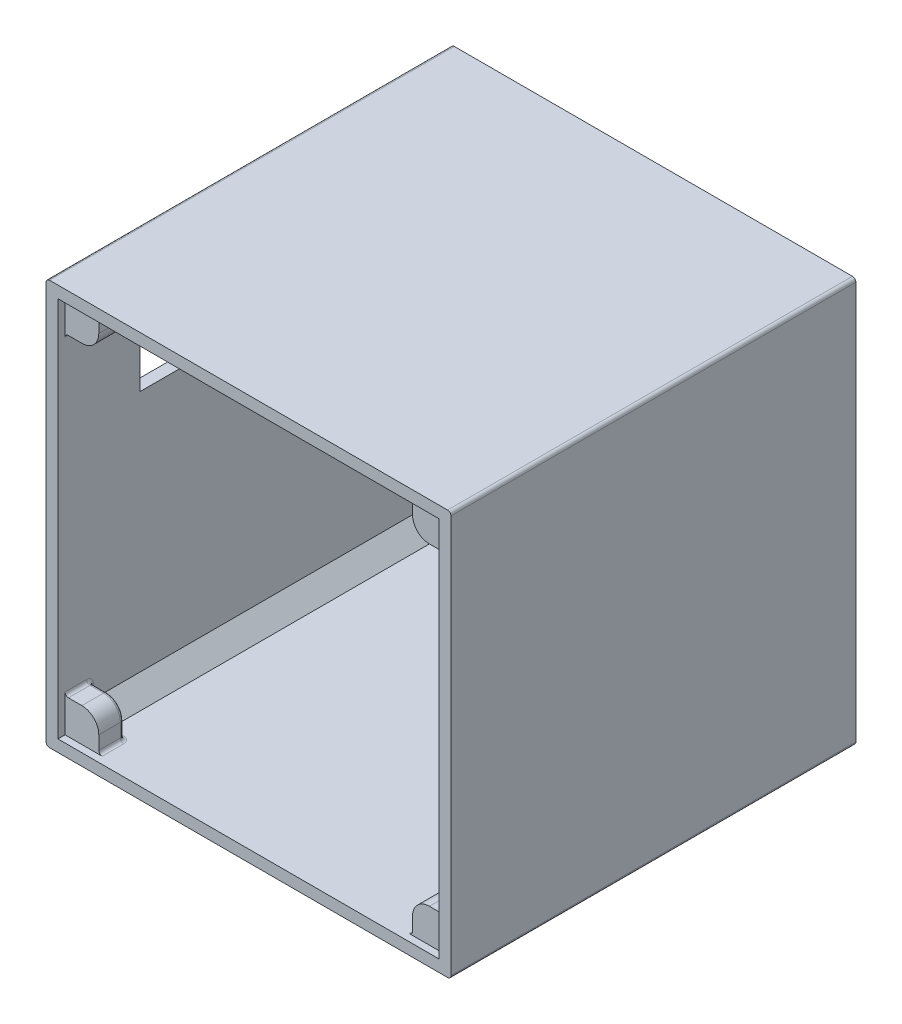
from build123d import *

# Parameters (mm, degrees)
ESBO_O2_W                     = 120
ESBO_O2_H                     = 120
RESSALTO_EXTRUS_O1_DEPTH      = 120
ESBO_O3_W                     = 113
ESBO_O3_H                     = 113
CORTE_EXTRUS_O1_DEPTH         = 120
RESSALTO_EXTRUS_O2_DEPTH      = 7
RESSALTO_EXTRUS_O6_DEPTH      = 7
CHANFRO1_SIZE                 = 5
CHANFRO2_SIZE                 = 5
ESBO_O14_W                    = 71.5
ESBO_O14_H                    = 24.5
CORTE_EXTRUS_O6_DEPTH         = 10
ESBO_O15_W                    = 113
ESBO_O15_H                    = 113
CORTE_EXTRUS_O7_DEPTH         = 5
FILETE3_R                     = 1
FILETE4_R                     = 1
RESSALTO_EXTRUS_O7_DEPTH      = 1.4
RESSALTO_EXTRUS_O7_DEPTH_BACK = 6
FILETE8_R                     = 1


with BuildPart() as part:
    # Esboço2 → Ressalto-extrusão1 (new body)
    with BuildSketch(Plane.XY):
        Rectangle(ESBO_O2_W, ESBO_O2_H)
    extrude(amount=RESSALTO_EXTRUS_O1_DEPTH)

    # Esboço3 → Corte-extrusão1 (cut)
    with BuildSketch(Plane.XY.offset(120)):
        Rectangle(ESBO_O3_W, ESBO_O3_H)
    extrude(amount=-CORTE_EXTRUS_O1_DEPTH, mode=Mode.SUBTRACT)

    # Esboço4 → Ressalto-extrusão2 (add)
    with BuildSketch(Plane.XY):
        with BuildLine():
            Line((-51.5, 46.5), (-56.5, 46.5))
            Line((-56.5, 46.5), (-56.5, 56.5))
            Line((-56.5, 56.5), (-46.5, 56.5))
            Line((-46.5, 56.5), (-46.5, 51.5))
            ThreePointArc((-46.5, 51.5), (-47.964466094, 47.964466094), (-51.5, 46.5))
        make_face()
        with BuildLine():
            Line((46.5, 56.5), (46.5, 51.5))
            ThreePointArc((46.5, 51.5), (47.964466094, 47.964466094), (51.5, 46.5))
            Line((51.5, 46.5), (56.5, 46.5))
            Line((56.5, 46.5), (56.5, 56.5))
            Line((56.5, 56.5), (46.5, 56.5))
        make_face()
        with BuildLine():
            Line((51.5, -46.5), (56.5, -46.5))
            Line((56.5, -46.5), (56.5, -56.5))
            Line((56.5, -56.5), (46.5, -56.5))
            Line((46.5, -56.5), (46.5, -51.5))
            ThreePointArc((46.5, -51.5), (47.964466094, -47.964466094), (51.5, -46.5))
        make_face()
        with BuildLine():
            Line((-46.5, -56.5), (-46.5, -51.5))
            ThreePointArc((-46.5, -51.5), (-47.964466094, -47.964466094), (-51.5, -46.5))
            Line((-51.5, -46.5), (-56.5, -46.5))
            Line((-56.5, -46.5), (-56.5, -56.5))
            Line((-56.5, -56.5), (-46.5, -56.5))
        make_face()
        with BuildLine():
            Line((-51.5, 5), (-56.5, 5))
            Line((-56.5, 5), (-56.5, -5))
            Line((-56.5, -5), (-51.5, -5))
            ThreePointArc((-51.5, -5), (-46.5, 0), (-51.5, 5))
        make_face()
        with BuildLine():
            Line((56.5, -5), (51.5, -5))
            ThreePointArc((51.5, -5), (46.5, 0), (51.5, 5))
            Line((51.5, 5), (56.5, 5))
            Line((56.5, 5), (56.5, -5))
        make_face()
        with BuildLine():
            Line((-5, 51.5), (-5, 56.5))
            Line((-5, 56.5), (5, 56.5))
            Line((5, 56.5), (5, 51.5))
            ThreePointArc((5, 51.5), (0, 46.5), (-5, 51.5))
        make_face()
    extrude(amount=RESSALTO_EXTRUS_O2_DEPTH)

    # Esboço13 → Ressalto-extrusão6 (add)
    with BuildSketch(Plane.XY):
        with BuildLine():
            Line((-5, -51.5), (-5, -56.5))
            Line((-5, -56.5), (5, -56.5))
            Line((5, -56.5), (5, -51.5))
            ThreePointArc((5, -51.5), (0, -46.5), (-5, -51.5))
        make_face()
    extrude(amount=RESSALTO_EXTRUS_O6_DEPTH)

    # Chanfro1
    chanfro1_edges = [part.edges().sort_by_distance(p)[0] for p in [
        (-56.5, 56.5, 63.5),
    ]]
    chamfer(chanfro1_edges, length=CHANFRO1_SIZE)

    # Chanfro2
    chanfro2_edges = [part.edges().sort_by_distance(p)[0] for p in [
        (-56.5, -56.5, 63.5),
        (56.5, -56.5, 63.5),
        (56.5, 56.5, 63.5),
    ]]
    chamfer(chanfro2_edges, length=CHANFRO2_SIZE)

    # Esboço14 → Corte-extrusão6 (cut)
    with BuildSketch(Plane.ZY.offset(60)):
        with Locations((60, 32.75)):
            Rectangle(ESBO_O14_W, ESBO_O14_H)
    extrude(amount=-CORTE_EXTRUS_O6_DEPTH, mode=Mode.SUBTRACT)

    # Esboço15 → Corte-extrusão7 (cut)
    with BuildSketch(Plane.XY.offset(120)):
        Rectangle(ESBO_O15_W, ESBO_O15_H)
    extrude(amount=-CORTE_EXTRUS_O7_DEPTH, mode=Mode.SUBTRACT)

    # Filete3
    filete3_edges = [part.edges().sort_by_distance(p)[0] for p in [
        (-60, 60, 60),
    ]]
    fillet(filete3_edges, radius=FILETE3_R)

    # Filete4
    filete4_edges = [part.edges().sort_by_distance(p)[0] for p in [
        (60, 60, 60),
        (60, -60, 60),
        (-60, -60, 60),
    ]]
    fillet(filete4_edges, radius=FILETE4_R)

    # Esboço5 → Ressalto-extrusão7 (add, two sides: drawn at the far end of the back side and taken through both)
    with BuildSketch(Plane.XY.offset(116.5).offset(-RESSALTO_EXTRUS_O7_DEPTH_BACK)):
        with BuildLine():
            Line((-51.5, 46.5), (-56.5, 46.5))
            Line((-56.5, 46.5), (-56.5, 56.5))
            Line((-56.5, 56.5), (-46.5, 56.5))
            Line((-46.5, 56.5), (-46.5, 51.5))
            ThreePointArc((-46.5, 51.5), (-47.964466094, 47.964466094), (-51.5, 46.5))
        make_face()
        with BuildLine():
            Line((46.5, 56.5), (46.5, 51.5))
            ThreePointArc((46.5, 51.5), (47.964466094, 47.964466094), (51.5, 46.5))
            Line((51.5, 46.5), (56.5, 46.5))
            Line((56.5, 46.5), (56.5, 56.5))
            Line((56.5, 56.5), (46.5, 56.5))
        make_face()
        with BuildLine():
            Line((51.5, -46.5), (56.5, -46.5))
            Line((56.5, -46.5), (56.5, -56.5))
            Line((56.5, -56.5), (46.5, -56.5))
            Line((46.5, -56.5), (46.5, -51.5))
            ThreePointArc((46.5, -51.5), (47.964466094, -47.964466094), (51.5, -46.5))
        make_face()
        with BuildLine():
            Line((-46.5, -56.5), (-46.5, -51.5))
            ThreePointArc((-46.5, -51.5), (-47.964466094, -47.964466094), (-51.5, -46.5))
            Line((-51.5, -46.5), (-56.5, -46.5))
            Line((-56.5, -46.5), (-56.5, -56.5))
            Line((-56.5, -56.5), (-46.5, -56.5))
        make_face()
    extrude(amount=RESSALTO_EXTRUS_O7_DEPTH + RESSALTO_EXTRUS_O7_DEPTH_BACK)

    # Filete8
    filete8_edges = [part.edges().sort_by_distance(p)[0] for p in [
        (56.5, 46.5, 3.5),
        (46.5, 56.5, 3.5),
        (54, 46.5, 7),
        (47.964466094, 47.964466094, 7),
        (46.5, 54, 7),
        (49, 56.5, 7),
        (54, 54, 7),
        (56.5, 49, 7),
        (56.5, -46.5, 114.2),
        (46.5, -56.5, 114.2),
        (-46.5, -56.5, 114.2),
        (-56.5, -46.5, 114.2),
        (-56.5, 46.5, 114.2),
        (-46.5, 56.5, 114.2),
        (46.5, 56.5, 114.2),
        (56.5, 46.5, 114.2),
        (56.5, 5, 3.5),
        (56.5, -5, 3.5),
        (46.5, -56.5, 3.5),
        (56.5, -46.5, 3.5),
        (5, -56.5, 3.5),
        (-5, -56.5, 3.5),
        (-56.5, -46.5, 3.5),
        (-46.5, -56.5, 3.5),
        (-56.5, -5, 3.5),
        (-56.5, 5, 3.5),
        (-46.5, 56.5, 3.5),
        (-56.5, 46.5, 3.5),
        (-5, 56.5, 3.5),
        (5, 56.5, 3.5),
        (54, -46.5, 110.5),
        (47.964466094, -47.964466094, 110.5),
        (46.5, -54, 110.5),
        (49, -56.5, 110.5),
        (54, -54, 110.5),
        (56.5, -49, 110.5),
        (-49, -56.5, 110.5),
        (-46.5, -54, 110.5),
        (-47.964466094, -47.964466094, 110.5),
        (-54, -46.5, 110.5),
        (-56.5, -49, 110.5),
        (-54, -54, 110.5),
        (-54, 46.5, 110.5),
        (-47.964466094, 47.964466094, 110.5),
        (-46.5, 54, 110.5),
        (-49, 56.5, 110.5),
        (-54, 54, 110.5),
        (-56.5, 49, 110.5),
        (49, 56.5, 110.5),
        (46.5, 54, 110.5),
        (47.964466094, 47.964466094, 110.5),
        (54, 46.5, 110.5),
        (56.5, 49, 110.5),
        (54, 54, 110.5),
        (54, 5, 7),
        (56.5, 0, 7),
        (54, -5, 7),
        (46.5, 0, 7),
        (46.5, -54, 7),
        (47.964466094, -47.964466094, 7),
        (54, -46.5, 7),
        (56.5, -49, 7),
        (54, -54, 7),
        (49, -56.5, 7),
        (5, -54, 7),
        (0, -56.5, 7),
        (-5, -54, 7),
        (0, -46.5, 7),
        (-54, -46.5, 7),
        (-47.964466094, -47.964466094, 7),
        (-46.5, -54, 7),
        (-49, -56.5, 7),
        (-54, -54, 7),
        (-56.5, -49, 7),
        (-54, -5, 7),
        (-56.5, 0, 7),
        (-54, 5, 7),
        (-46.5, 0, 7),
        (-46.5, 54, 7),
        (-47.964466094, 47.964466094, 7),
        (-54, 46.5, 7),
        (-56.5, 49, 7),
        (-54, 54, 7),
        (-49, 56.5, 7),
        (0, 46.5, 7),
        (-5, 54, 7),
        (0, 56.5, 7),
        (5, 54, 7),
    ]]
    fillet(filete8_edges, radius=FILETE8_R)


solid = part.part
